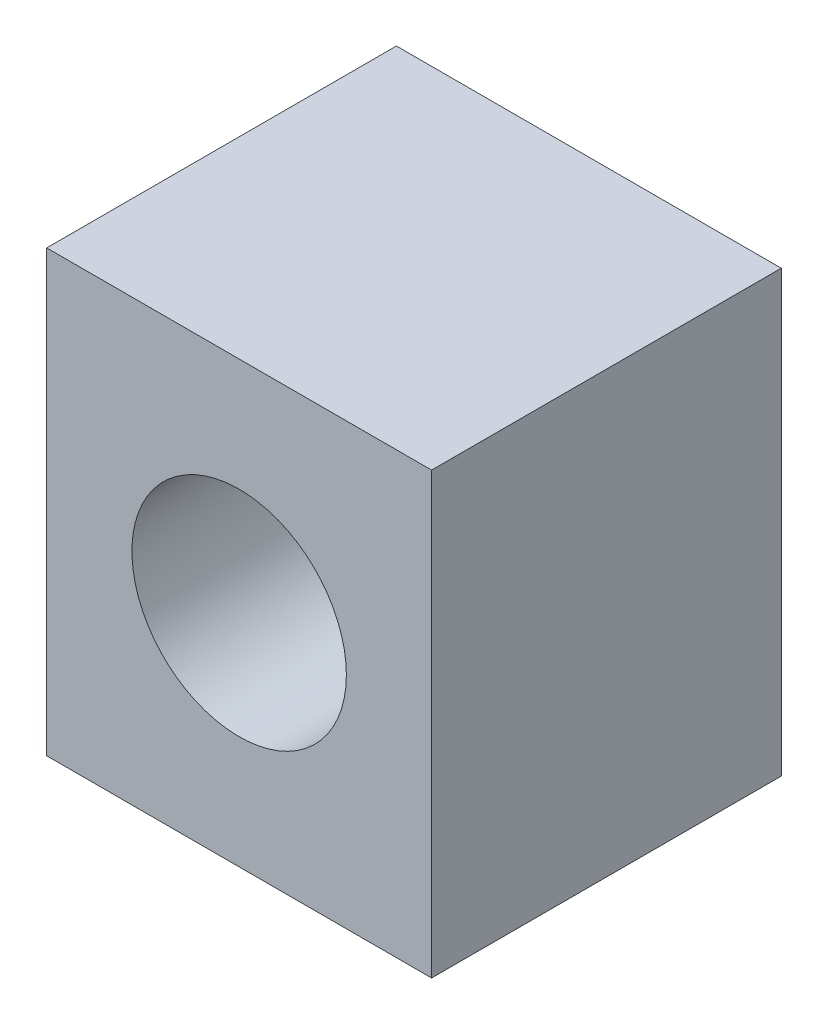
from build123d import *

# Parameters (mm, degrees)
SKETCH2_W           = 3.5
SKETCH2_H           = 4
BOSS_EXTRUDE1_DEPTH = 3.18
SKETCH3_R           = 0.975
CUT_EXTRUDE1_DEPTH  = 5.144261092


with BuildPart() as part:
    # Sketch2 → Boss-Extrude1 (new body)
    with BuildSketch(Plane.XY):
        Rectangle(SKETCH2_W, SKETCH2_H)
    extrude(amount=BOSS_EXTRUDE1_DEPTH)

    # Sketch3 → Cut-Extrude1 (cut, through all)
    with BuildSketch(Plane.XY.offset(3.18)):
        Circle(SKETCH3_R)
    extrude(amount=-CUT_EXTRUDE1_DEPTH, mode=Mode.SUBTRACT)


solid = part.part
